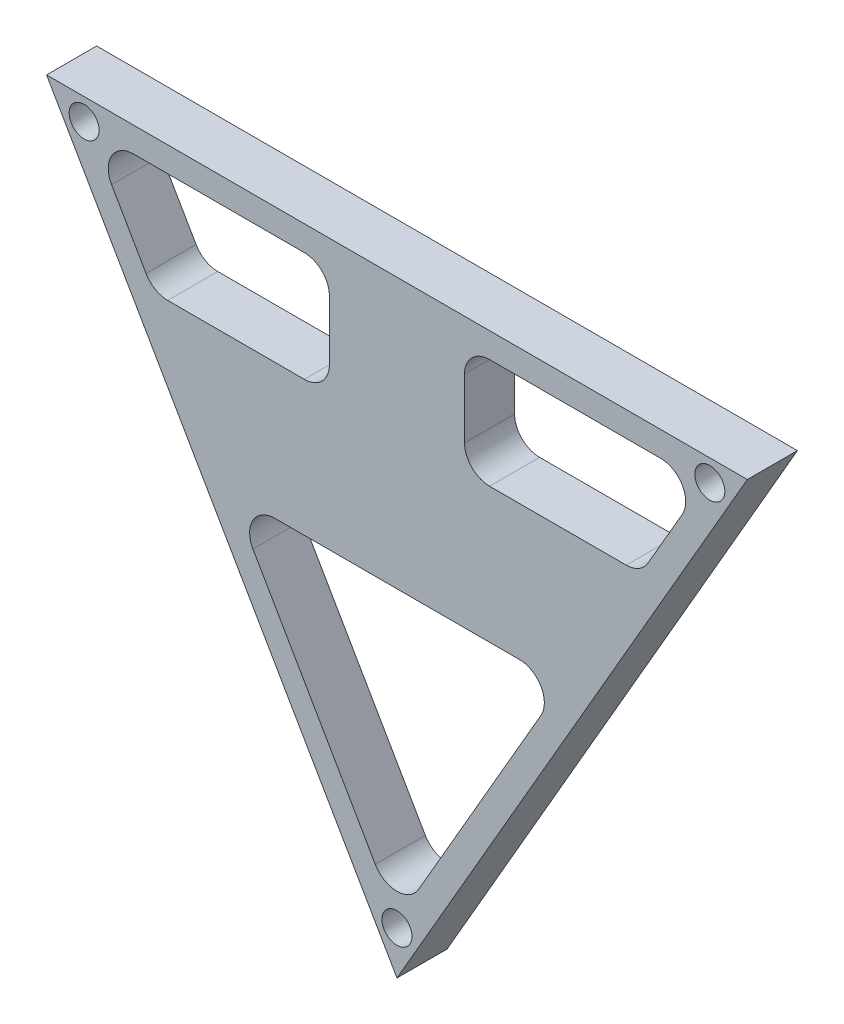
from build123d import *

# Parameters (mm, degrees)
BOSS_EXTRUDE1_DEPTH      = 10
SKETCH2_W                = 23
SKETCH2_H                = 23
CUT_EXTRUDE1_DEPTH       = 3
CUT_EXTRUDE2_DEPTH       = 108.15565003
CUT_EXTRUDE2_DEPTH_BACK  = 108.15565003
SKETCH3_R                = 1.5
CUT_EXTRUDE3_DEPTH       = 108.393357957
CUT_EXTRUDE3_DEPTH_BACK  = 3
SKETCH4_W                = 20.26
SKETCH4_H                = 15.56
CUT_EXTRUDE4_DEPTH       = 108.15565003
CUT_EXTRUDE4_DEPTH_BACK  = 108.15565003
SKETCH5_R                = 1.425
CUT_EXTRUDE6_DEPTH       = 108.393357957
CUT_EXTRUDE6_DEPTH_BACK  = 108.393357957
FILLET1_R                = 5
SKETCH8_W                = 20.26
SKETCH8_H                = 3
CUT_EXTRUDE8_DEPTH       = 28.72
CHAMFER1_SIZE            = 1.37
SKETCH9_R                = 1.65
CUT_EXTRUDE9_DEPTH       = 108.393357957
SKETCH10_R               = 3
CUT_EXTRUDE10_DEPTH      = 5
BOSS_EXTRUDE2_DEPTH      = 2.5
BOSS_EXTRUDE2_DEPTH_BACK = 7
SKETCH12_R               = 1.75
SKETCH12_R_2             = 1.425
CHAMFER2_SIZE            = 2
CHAMFER3_SIZE            = 1.25


# Some blends are built 0.0001 mm under size
with BuildPart() as part:
    # Sketch1 → Boss-Extrude1 (new body)
    with BuildSketch(Plane.XY):
        Polygon((0, -80.829037687), (70, 40.414518843), (-70, 40.414518843), align=None)
    extrude(amount=BOSS_EXTRUDE1_DEPTH)

    # Sketch2 → Cut-Extrude1 (cut)
    with BuildSketch(Plane(origin=(0, 0, 0), x_dir=(-1, 0, 0), z_dir=(0, 0, -1))):
        Rectangle(SKETCH2_W, SKETCH2_H)
    extrude(amount=-CUT_EXTRUDE1_DEPTH, mode=Mode.SUBTRACT)

    # Sketch3 → Cut-Extrude2 (cut, two sides: drawn at the far end of the back side and taken through both)
    with BuildSketch(Plane(origin=(0, 0, 3), x_dir=(-1, 0, 0), z_dir=(0, 0, -1)).offset(-CUT_EXTRUDE2_DEPTH_BACK)):
        with Locations((-8, 8)):
            Circle(SKETCH3_R)
        with Locations((8, 8)):
            Circle(SKETCH3_R)
        with Locations((8, -8)):
            Circle(SKETCH3_R)
        with Locations((-8, -8)):
            Circle(SKETCH3_R)
    extrude(amount=CUT_EXTRUDE2_DEPTH + CUT_EXTRUDE2_DEPTH_BACK, mode=Mode.SUBTRACT)

    # Sketch4 → Cut-Extrude3 (cut, two sides: drawn at the far end of the back side and taken through both)
    with BuildSketch(Plane(origin=(0, 0, 0), x_dir=(-1, 0, 0), z_dir=(0, 0, -1)).offset(-CUT_EXTRUDE3_DEPTH_BACK)):
        with Locations((0, 25)):
            Rectangle(SKETCH4_W, SKETCH4_H)
    extrude(amount=CUT_EXTRUDE3_DEPTH + CUT_EXTRUDE3_DEPTH_BACK, mode=Mode.SUBTRACT)

    # Sketch5 → Cut-Extrude4 (cut, two sides: drawn at the far end of the back side and taken through both)
    with BuildSketch(Plane(origin=(0, 0, 3), x_dir=(-1, 0, 0), z_dir=(0, 0, -1)).offset(-CUT_EXTRUDE4_DEPTH_BACK)):
        with Locations((-7.53, 30.14)):
            Circle(SKETCH5_R)
        with Locations((7.53, 30.14)):
            Circle(SKETCH5_R)
    extrude(amount=CUT_EXTRUDE4_DEPTH + CUT_EXTRUDE4_DEPTH_BACK, mode=Mode.SUBTRACT)

    # Sketch6 → Cut-Extrude6 (cut, two sides: drawn at the far end of the back side and taken through both)
    with BuildSketch(Plane(origin=(0, 0, 0), x_dir=(-1, 0, 0), z_dir=(0, 0, -1)).offset(-CUT_EXTRUDE6_DEPTH_BACK)):
        Polygon((-13.5, 13.5), (-13.5, 35.414518843), (-61.339745962, 35.414518843), (-48.687392609, 13.5), align=None)
        Polygon((13.5, 13.5), (48.687392609, 13.5), (61.339745962, 35.414518843), (13.5, 35.414518843), align=None)
        Polygon((-13.5, -13.5), (-33.098935341, -13.5), (0, -70.829037687), (33.098935341, -13.5), (13.5, -13.5), align=None)
    extrude(amount=CUT_EXTRUDE6_DEPTH + CUT_EXTRUDE6_DEPTH_BACK, mode=Mode.SUBTRACT)

    # Fillet1
    fillet1_edges = [part.edges().sort_by_distance(p)[0] for p in [
        (13.5, 35.414518843, 5),
        (13.5, 13.5, 5),
        (48.687392609, 13.5, 5),
        (61.339745962, 35.414518843, 5),
        (33.098935341, -13.5, 5),
        (-33.098935341, -13.5, 5),
        (0, -70.829037687, 5),
        (-48.687392609, 13.5, 5),
        (-13.5, 13.5, 5),
        (-13.5, 35.414518843, 5),
        (-61.339745962, 35.414518843, 5),
    ]]
    fillet(fillet1_edges, radius=FILLET1_R)

    # Sketch8 → Cut-Extrude8 (cut)
    with BuildSketch(Plane(origin=(0, 17.22, 0), x_dir=(1, 0, 0), z_dir=(0, 1, 0))):
        with Locations((0, -1.5)):
            Rectangle(SKETCH8_W, SKETCH8_H)
    extrude(amount=-CUT_EXTRUDE8_DEPTH, mode=Mode.SUBTRACT)

    # Chamfer1
    chamfer1_edges = [part.edges().sort_by_distance(p)[0] for p in [
        (10.13, 11.5, 1.5),
        (-10.13, 11.5, 1.5),
    ]]
    chamfer(chamfer1_edges, length=CHAMFER1_SIZE - 0.0001)  # a hair under: the kernel refuses the full size

    # Sketch9 → Cut-Extrude9 (cut, through all)
    with BuildSketch(Plane(origin=(0, 0, 0), x_dir=(-1, 0, 0), z_dir=(0, 0, -1))):
        with Locations((-62.5, 36.084391824)):
            Circle(SKETCH9_R)
        with Locations((62.5, 36.084391824)):
            Circle(SKETCH9_R)
        with Locations((0, -72.168783649)):
            Circle(SKETCH9_R)
    extrude(amount=-CUT_EXTRUDE9_DEPTH, mode=Mode.SUBTRACT)

    # Sketch10 → Cut-Extrude10 (cut)
    with BuildSketch(Plane(origin=(0, 0, 10), x_dir=(-1, 0, 0), z_dir=(0, 0, -1))):
        with Locations(Location((-62.5, 36.084391824, 0), (0, 0, 180))):
            Circle(SKETCH10_R)
        with Locations(Location((62.5, 36.084391824, 0), (0, 0, 180))):
            Circle(SKETCH10_R)
        with Locations(Location((0, -72.168783649, 0), (0, 0, 180))):
            Circle(SKETCH10_R)
    extrude(amount=CUT_EXTRUDE10_DEPTH, mode=Mode.SUBTRACT)

    # Sketch12 → Boss-Extrude2 (add, two sides: drawn at the far end of the back side and taken through both)
    with BuildSketch(Plane(origin=(0, 0, 3), x_dir=(-1, 0, 0), z_dir=(0, 0, -1)).offset(-BOSS_EXTRUDE2_DEPTH_BACK)):
        with Locations((-8, 8)):
            Circle(SKETCH12_R)
        with Locations((8, 8)):
            Circle(SKETCH12_R)
        with Locations((8, -8)):
            Circle(SKETCH12_R)
        with Locations((-8, -8)):
            Circle(SKETCH12_R)
        with Locations((-7.53, 30.14)):
            Circle(SKETCH12_R_2)
        with Locations((7.53, 30.14)):
            Circle(SKETCH12_R_2)
    extrude(amount=BOSS_EXTRUDE2_DEPTH + BOSS_EXTRUDE2_DEPTH_BACK)

    # Chamfer2
    # the kernel refuses this chamfer: 2 mm, written as the material it takes off along each edge
    with BuildSketch(Plane(origin=(62.5, 36.084391824, 5), x_dir=(-1, 0, 0), z_dir=(0, -1, 0))) as chamfer2_piece_1_section:
        Polygon((1.65, CHAMFER2_SIZE), (1.65 + CHAMFER2_SIZE, 0), (1.65, 0), align=None)
    chamfer2_piece_1 = revolve(axis=Axis((62.5, 36.084391824, 5), (0, 0, -1)), mode=Mode.PRIVATE)
    chamfer2_piece_1 = chamfer2_piece_1 & Plane(origin=(62.5, 36.084391824, 3.667830139), x_dir=(1, 0, 0), z_dir=(0, 0, 1)) * Cylinder(3, 15, mode=Mode.PRIVATE)
    add(chamfer2_piece_1, mode=Mode.SUBTRACT)
    with BuildSketch(Plane(origin=(-62.5, 36.084391824, 5), x_dir=(-1, 0, 0), z_dir=(0, -1, 0))) as chamfer2_piece_2_section:
        Polygon((1.65, CHAMFER2_SIZE), (1.65 + CHAMFER2_SIZE, 0), (1.65, 0), align=None)
    chamfer2_piece_2 = revolve(axis=Axis((-62.5, 36.084391824, 5), (0, 0, -1)), mode=Mode.PRIVATE)
    chamfer2_piece_2 = chamfer2_piece_2 & Plane(origin=(-62.5, 36.084391824, 3.667830139), x_dir=(1, 0, 0), z_dir=(0, 0, 1)) * Cylinder(3, 15, mode=Mode.PRIVATE)
    add(chamfer2_piece_2, mode=Mode.SUBTRACT)
    with BuildSketch(Plane(origin=(0, -72.168783649, 5), x_dir=(-1, 0, 0), z_dir=(0, -1, 0))) as chamfer2_piece_3_section:
        Polygon((1.65, CHAMFER2_SIZE), (1.65 + CHAMFER2_SIZE, 0), (1.65, 0), align=None)
    chamfer2_piece_3 = revolve(axis=Axis((0, -72.168783649, 5), (0, 0, -1)), mode=Mode.PRIVATE)
    chamfer2_piece_3 = chamfer2_piece_3 & Plane(origin=(0, -72.168783649, 3.667830139), x_dir=(1, 0, 0), z_dir=(0, 0, 1)) * Cylinder(3, 15, mode=Mode.PRIVATE)
    add(chamfer2_piece_3, mode=Mode.SUBTRACT)

    # Chamfer3
    chamfer3_edges = [part.edges().sort_by_distance(p)[0] for p in [
        (9.75, 8, 0.5),
        (-6.25, 8, 0.5),
        (-6.25, -8, 0.5),
        (9.75, -8, 0.5),
        (8.955, 30.14, 0.5),
        (-6.105, 30.14, 0.5),
    ]]
    chamfer(chamfer3_edges, length=CHAMFER3_SIZE)


solid = part.part
